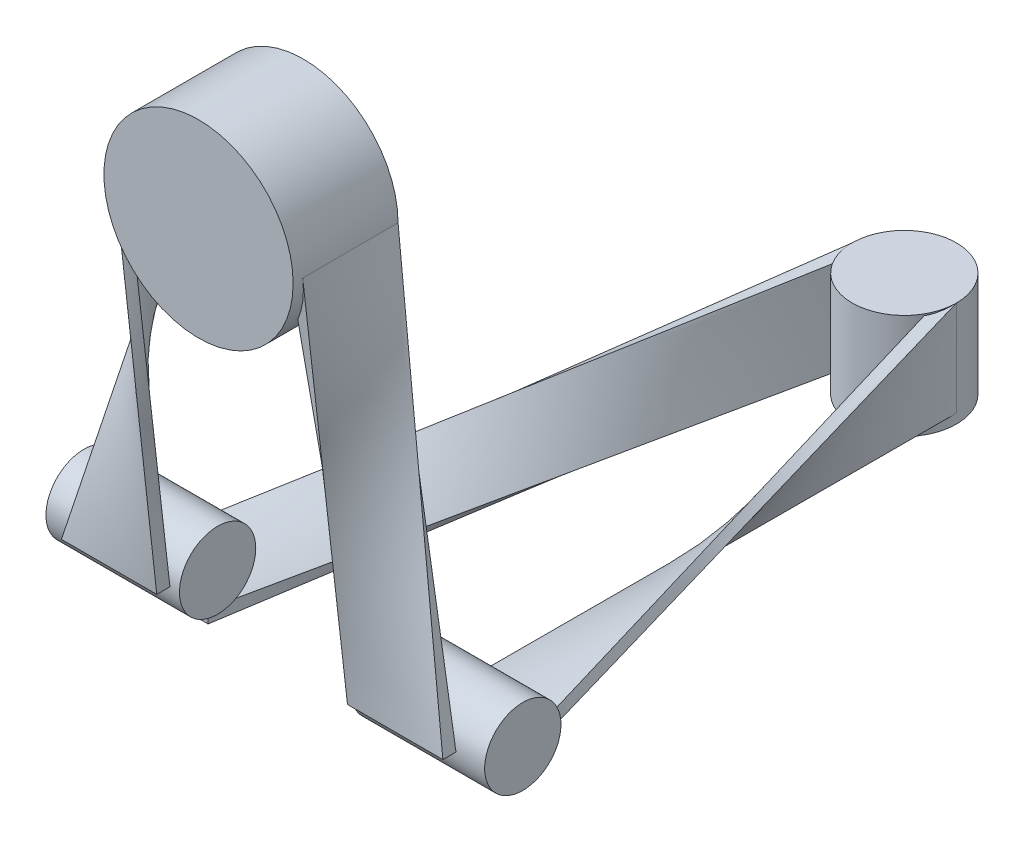
from build123d import *

# Parameters (mm, degrees)
SKETCH_1_R      = 9.919796
EXTRUDE_1_DEPTH = 11
SKETCH_3_R      = 5.463458
EXTRUDE_2_DEPTH = 11
EXTRUDE_START   = 9
SKETCH_4_R      = 4
EXTRUDE_3_DEPTH = 14
EXTRUDE_START_2 = -9
SKETCH_4_3_R    = 4
EXTRUDE_4_DEPTH = 14


with BuildPart() as part:
    # Эскиз1 → Бобышка-Вытянуть1 (new body)
    with BuildSketch(Plane.XY):
        Circle(SKETCH_1_R)
    extrude(amount=EXTRUDE_1_DEPTH)


with BuildPart() as body_2:
    # Эскиз3 → Бобышка-Вытянуть2 (new body)
    with BuildSketch(Plane(origin=(0, -41, 0), x_dir=(1, 0, 0), z_dir=(0, 1, 0))):
        with Locations(Location((0, 63, 0), (0, 0, 270))):
            Circle(SKETCH_3_R)
    extrude(amount=-EXTRUDE_2_DEPTH)


with BuildPart() as body_3:
    # Эскиз4 → Бобышка-Вытянуть3 (new body)
    with BuildSketch(Plane(origin=(0, 0, 0), x_dir=(0, 0, -1), z_dir=(1, 0, 0)).offset(EXTRUDE_START)):
        with Locations((0, -41)):
            Circle(SKETCH_4_R)
    extrude(amount=EXTRUDE_3_DEPTH)


with BuildPart() as body_4:
    # Эскиз4<3> → Бобышка-Вытянуть4 (new body)
    with BuildSketch(Plane(origin=(0, 0, 0), x_dir=(0, 0, -1), z_dir=(1, 0, 0)).offset(EXTRUDE_START_2)):
        with Locations((0, -41)):
            Circle(SKETCH_4_3_R)
    extrude(amount=-EXTRUDE_4_DEPTH)


with BuildPart() as body_5:
    # По сечениям1: read off the stored shape, not the designer's step
    # По сечениям1: loft between two sections, ruled curve by curve
    loft_1_from = [
        Edge.make_bspline([(9.919796, 0, 10), (9.689796, 0, 10), (9.459796, 0, 10), (8.999796, 0, 10), (8.769796, 0, 10), (8.539796, 0, 10)], [0, 0, 0, 0, 0.5, 0.5, 1, 1, 1, 1], 3),
        Edge.make_bspline([(8.539796, 0, 10), (8.539796, 0, 8.333333333), (8.539796, 0, 6.666666667), (8.539796, 0, 3.333333333), (8.539796, 0, 1.666666667), (8.539796, 0, 0)], [0, 0, 0, 0, 0.5, 0.5, 1, 1, 1, 1], 3),
        Edge.make_bspline([(9.919796, 0, 0), (9.919796, 0, 1.666666667), (9.919796, 0, 3.333333333), (9.919796, 0, 6.666666667), (9.919796, 0, 8.333333333), (9.919796, 0, 10)], [0, 0, 0, 0, 0.5, 0.5, 1, 1, 1, 1], 3),
        Edge.make_bspline([(8.539796, 0, 0), (8.769796, 0, 0), (8.999796, 0, 0), (9.459796, 0, 0), (9.689796, 0, 0), (9.919796, 0, 0)], [0, 0, 0, 0, 0.5, 0.5, 1, 1, 1, 1], 3),
    ]
    loft_1_to = [
        Edge.make_bspline([(10, -41, 5.38), (10, -41, 5.15), (10, -41, 4.92), (10, -41, 4.46), (10, -41, 4.23), (10, -41, 4)], [0, 0, 0, 0, 0.5, 0.5, 1, 1, 1, 1], 3),
        Edge.make_bspline([(10, -41, 4), (11.666666667, -41, 4), (13.333333333, -41, 4), (16.666666667, -41, 4), (18.333333333, -41, 4), (20, -41, 4)], [0, 0, 0, 0, 0.5, 0.5, 1, 1, 1, 1], 3),
        Edge.make_bspline([(20, -41, 5.38), (18.333333333, -41, 5.38), (16.666666667, -41, 5.38), (13.333333333, -41, 5.38), (11.666666667, -41, 5.38), (10, -41, 5.38)], [0, 0, 0, 0, 0.5, 0.5, 1, 1, 1, 1], 3),
        Edge.make_bspline([(20, -41, 4), (20, -41, 4.23), (20, -41, 4.46), (20, -41, 4.92), (20, -41, 5.15), (20, -41, 5.38)], [0, 0, 0, 0, 0.5, 0.5, 1, 1, 1, 1], 3),
    ]
    loft_1 = Solid(Shell([*[Face.make_surface_from_curves(loft_1_from[k], loft_1_to[k]) for k in range(4)], Face(Wire(loft_1_from)), Face(Wire(loft_1_to))]))
    add(loft_1)


with BuildPart() as body_6:
    # По сечениям3: read off the stored shape, not the designer's step
    # По сечениям3: loft between two sections, ruled curve by curve
    loft_3_from = [
        Edge.make_bspline([(20, -46.38, 0), (18.333333333, -46.38, 0), (16.666666667, -46.38, 0), (13.333333333, -46.38, 0), (11.666666667, -46.38, 0), (10, -46.38, 0)], [0, 0, 0, 0, 0.5, 0.5, 1, 1, 1, 1], 3),
        Edge.make_bspline([(10, -46.38, 0), (10, -46.15, 0), (10, -45.92, 0), (10, -45.46, 0), (10, -45.23, 0), (10, -45, 0)], [0, 0, 0, 0, 0.5, 0.5, 1, 1, 1, 1], 3),
        Edge.make_bspline([(20, -45, 0), (20, -45.23, 0), (20, -45.46, 0), (20, -45.92, 0), (20, -46.15, 0), (20, -46.38, 0)], [0, 0, 0, 0, 0.5, 0.5, 1, 1, 1, 1], 3),
        Edge.make_bspline([(10, -45, 0), (11.666666667, -45, 0), (13.333333333, -45, 0), (16.666666667, -45, 0), (18.333333333, -45, 0), (20, -45, 0)], [0, 0, 0, 0, 0.5, 0.5, 1, 1, 1, 1], 3),
    ]
    loft_3_to = [
        Edge.make_bspline([(5.463458, -41, -63), (5.463458, -42.666666667, -63), (5.463458, -44.333333333, -63), (5.463458, -47.666666667, -63), (5.463458, -49.333333333, -63), (5.463458, -51, -63)], [0, 0, 0, 0, 0.5, 0.5, 1, 1, 1, 1], 3),
        Edge.make_bspline([(5.463458, -51, -63), (5.233458, -51, -63), (5.003458, -51, -63), (4.543458, -51, -63), (4.313458, -51, -63), (4.083458, -51, -63)], [0, 0, 0, 0, 0.5, 0.5, 1, 1, 1, 1], 3),
        Edge.make_bspline([(4.083458, -41, -63), (4.313458, -41, -63), (4.543458, -41, -63), (5.003458, -41, -63), (5.233458, -41, -63), (5.463458, -41, -63)], [0, 0, 0, 0, 0.5, 0.5, 1, 1, 1, 1], 3),
        Edge.make_bspline([(4.083458, -51, -63), (4.083458, -49.333333333, -63), (4.083458, -47.666666667, -63), (4.083458, -44.333333333, -63), (4.083458, -42.666666667, -63), (4.083458, -41, -63)], [0, 0, 0, 0, 0.5, 0.5, 1, 1, 1, 1], 3),
    ]
    loft_3 = Solid(Shell([*[Face.make_surface_from_curves(loft_3_from[k], loft_3_to[k]) for k in range(4)], Face(Wire(loft_3_from)), Face(Wire(loft_3_to))]))
    add(loft_3)


with BuildPart() as body_7:
    # Зеркальное отражение7: mirrored copy
    add(body_6.part.mirror(Plane(origin=(0, 0, 0), x_dir=(0, 0, 1), z_dir=(1, 0, 0))))


with BuildPart() as body_8:
    # Mirror 7 2: mirrored copy
    add(body_5.part.mirror(Plane(origin=(0, 0, 0), x_dir=(0, 0, 1), z_dir=(1, 0, 0))))


solid = Compound([part.part, body_2.part, body_3.part, body_4.part, body_5.part, body_6.part, body_7.part, body_8.part])
